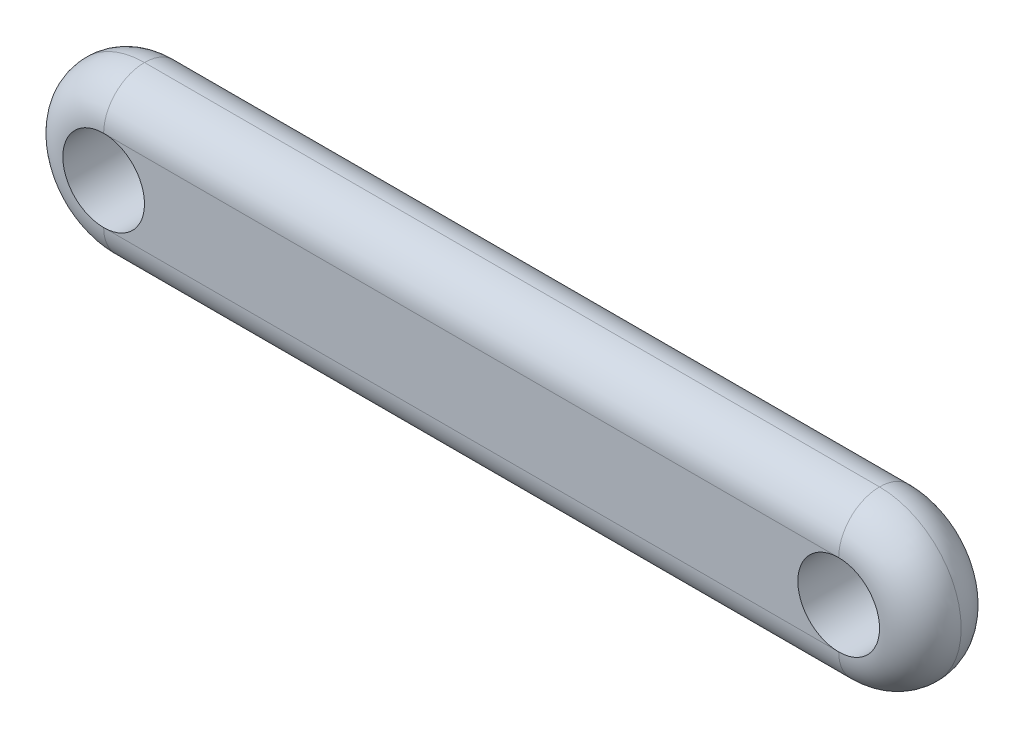
from build123d import *

# Parameters (mm, degrees)
SKETCH2_R           = 2.5
BOSS_EXTRUDE1_DEPTH = 5
FILLET1_R           = 2.5


with BuildPart() as part:
    # Sketch2 → Boss-Extrude1 (new body)
    with BuildSketch(Plane.XY):
        with BuildLine():
            Line((-22.5, 5), (22.5, 5))
            ThreePointArc((22.5, 5), (27.5, 0), (22.5, -5))
            Line((22.5, -5), (-22.5, -5))
            ThreePointArc((-22.5, -5), (-27.5, 0), (-22.5, 5))
        make_face()
        with Locations((-22.5, 0)):
            Circle(SKETCH2_R, mode=Mode.SUBTRACT)
        with Locations(Location((22.5, 0, 0), (0, 0, 180))):
            Circle(SKETCH2_R, mode=Mode.SUBTRACT)
    extrude(amount=BOSS_EXTRUDE1_DEPTH)

    # Fillet1
    fillet1_edges = [part.edges().sort_by_distance(p)[0] for p in [
        (0, -5, 5),
        (0, -5, 0),
        (27.5, 0, 5),
        (27.5, 0, 0),
        (-27.5, 0, 5),
        (-27.5, 0, 0),
        (0, 5, 5),
        (0, 5, 0),
    ]]
    fillet(fillet1_edges, radius=FILLET1_R - 0.0001)  # a hair under: the kernel refuses the full size


solid = part.part
